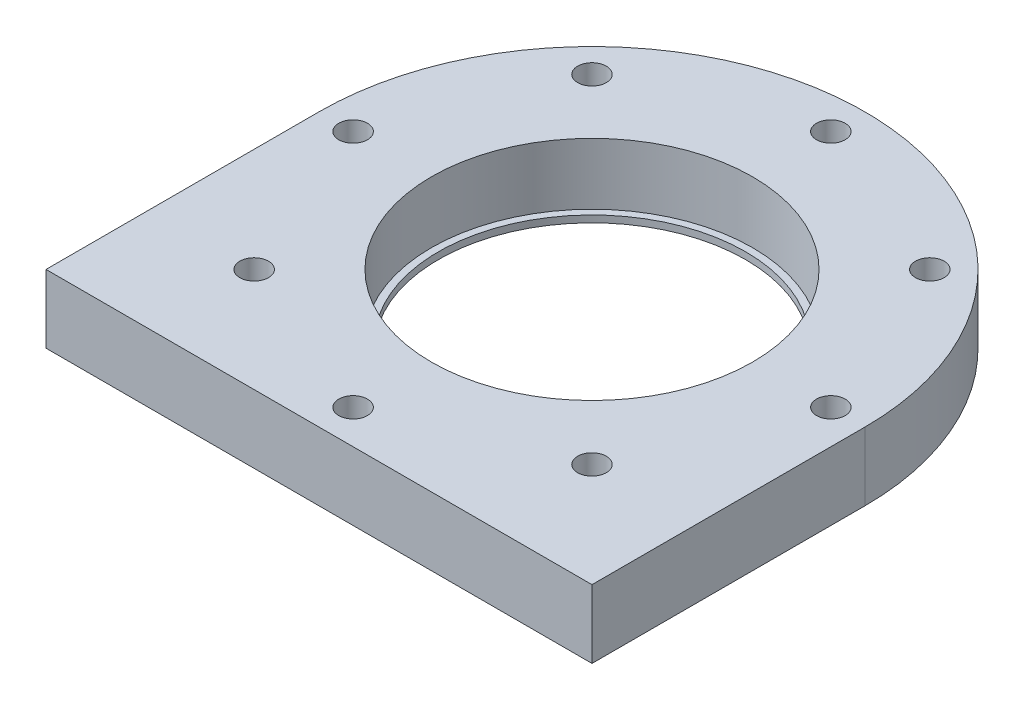
from build123d import *

# Parameters (mm, degrees)
SKETCH_1_R          = 22.5
EXTRUDE_1_DEPTH     = 10
SKETCH_2_R          = 2.1
CUT_EXTRUDE_1_DEPTH = 58.445626465
SKETCH_5_R          = 23.525
CUT_EXTRUDE_2_DEPTH = 9


with BuildPart() as part:
    # 草图1 → 凸台-拉伸1 (new body)
    with BuildSketch(Plane(origin=(0, 0, 0), x_dir=(1, 0, 0), z_dir=(0, 1, 0))):
        with BuildLine():
            Line((-40, 0), (-40, -40))
            Line((-40, -40), (40, -40))
            Line((40, -40), (40, 0))
            ThreePointArc((40, 0), (0, 40), (-40, 0))
        make_face()
        Circle(SKETCH_1_R, mode=Mode.SUBTRACT)
    extrude(amount=EXTRUDE_1_DEPTH)

    # 草图2 → 切除-拉伸1 (cut, through all)
    with BuildSketch(Plane(origin=(0, 10, 0), x_dir=(1, 0, 0), z_dir=(0, 1, 0))):
        with Locations((0, 35)):
            Circle(SKETCH_2_R)
        with Locations((24.748737342, 24.748737342)):
            Circle(SKETCH_2_R)
        with Locations((35, 0)):
            Circle(SKETCH_2_R)
        with Locations((24.748737342, -24.748737342)):
            Circle(SKETCH_2_R)
        with Locations((0, -35)):
            Circle(SKETCH_2_R)
        with Locations((-24.748737342, -24.748737342)):
            Circle(SKETCH_2_R)
        with Locations((-35, 0)):
            Circle(SKETCH_2_R)
        with Locations((-24.748737342, 24.748737342)):
            Circle(SKETCH_2_R)
    extrude(amount=-CUT_EXTRUDE_1_DEPTH, mode=Mode.SUBTRACT)

    # 草图5 → 切除-拉伸2 (cut)
    with BuildSketch(Plane(origin=(0, 10, 0), x_dir=(1, 0, 0), z_dir=(0, 1, 0))):
        Circle(SKETCH_5_R)
    extrude(amount=-CUT_EXTRUDE_2_DEPTH, mode=Mode.SUBTRACT)


solid = part.part
